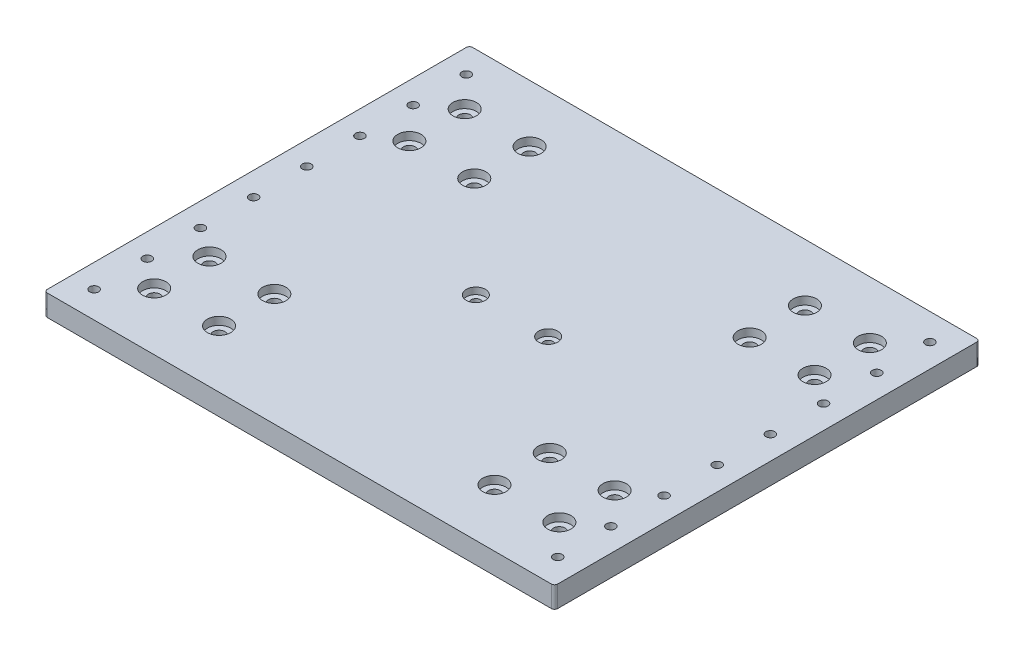
from build123d import *

# Parameters (mm, degrees)
SKETCH1_W                                        = 240
SKETCH1_H                                        = 200
BOSS_EXTRUDE1_DEPTH                              = 5
CBORE_FOR_M5_PAN_HEAD_MACHINE_SCREW1_D           = 5.5
CBORE_FOR_M5_PAN_HEAD_MACHINE_SCREW1_CBORE_D     = 11
CBORE_FOR_M5_PAN_HEAD_MACHINE_SCREW1_CBORE_DEPTH = 3.7
MIRROR2_COPY_1_D                                 = 5.5
MIRROR2_COPY_1_CBORE_D                           = 11
MIRROR2_COPY_1_CBORE_DEPTH                       = 3.7
MIRROR2_COPY_2_D                                 = 5.5
MIRROR2_COPY_2_CBORE_D                           = 11
MIRROR2_COPY_2_CBORE_DEPTH                       = 3.7
CBORE_FOR_M4_PAN_HEAD_MACHINE_SCREW1_D           = 4.5
CBORE_FOR_M4_PAN_HEAD_MACHINE_SCREW1_CBORE_D     = 9
CBORE_FOR_M4_PAN_HEAD_MACHINE_SCREW1_CBORE_DEPTH = 3.1
M5X0_8_TAPPED_HOLE1_D                            = 4.2
FILLET1_R                                        = 1.5
LPATTERN2_COUNT                                  = 8
LPATTERN2_PITCH                                  = 25


with BuildPart() as part:
    # Sketch1 → Boss-Extrude1 (new, symmetric)
    with BuildSketch(Plane(origin=(0, 0, 0), x_dir=(1, 0, 0), z_dir=(0, 1, 0))):
        Rectangle(SKETCH1_W, SKETCH1_H)
    extrude(amount=BOSS_EXTRUDE1_DEPTH, both=True)

    # CBORE for M5 Pan Head Machine Screw1 (through all)
    with Locations(Plane(origin=(66.92305649, 5, -81.969265096), x_dir=(-1, 0, 0), z_dir=(0, 1, 0))):
        with Locations((162.17305649, 154.969265096), (131.67305649, 154.969265096), (131.67305649, 128.969265096), (162.17305649, 128.969265096)):
            cbore_for_m5_pan_head_machine_screw1 = CounterBoreHole(CBORE_FOR_M5_PAN_HEAD_MACHINE_SCREW1_D / 2, CBORE_FOR_M5_PAN_HEAD_MACHINE_SCREW1_CBORE_D / 2, CBORE_FOR_M5_PAN_HEAD_MACHINE_SCREW1_CBORE_DEPTH)

    # Mirror1: CBORE for M5 Pan Head Machine Screw1 across plane
    add(cbore_for_m5_pan_head_machine_screw1.mirror(Plane(origin=(0, 0, 0), x_dir=(0, 0, 1), z_dir=(1, 0, 0))), mode=Mode.SUBTRACT)

    # Mirror2 copy 1 (through all)
    with Locations(Plane(origin=(-66.92305649, 5, 81.969265096), x_dir=(1, 0, 0), z_dir=(0, 1, 0))):
        with Locations((162.17305649, 154.969265096), (131.67305649, 154.969265096), (131.67305649, 128.969265096), (162.17305649, 128.969265096)):
            CounterBoreHole(MIRROR2_COPY_1_D / 2, MIRROR2_COPY_1_CBORE_D / 2, MIRROR2_COPY_1_CBORE_DEPTH)

    # Mirror2 copy 2 (through all)
    with Locations(Plane(origin=(66.92305649, 5, 81.969265096), x_dir=(-1, 0, 0), z_dir=(0, 1, 0))):
        with Locations((162.17305649, -154.969265096), (131.67305649, -154.969265096), (131.67305649, -128.969265096), (162.17305649, -128.969265096)):
            CounterBoreHole(MIRROR2_COPY_2_D / 2, MIRROR2_COPY_2_CBORE_D / 2, MIRROR2_COPY_2_CBORE_DEPTH)

    # CBORE for M4 Pan Head Machine Screw1 (through all)
    with Locations(Plane(origin=(-30.338508942, 5, -23.538498317), x_dir=(-1, 0, 0), z_dir=(0, 1, 0))):
        with Locations((-13.338508942, 23.538498317), (-47.338508942, 23.538498317)):
            CounterBoreHole(CBORE_FOR_M4_PAN_HEAD_MACHINE_SCREW1_D / 2, CBORE_FOR_M4_PAN_HEAD_MACHINE_SCREW1_CBORE_D / 2, CBORE_FOR_M4_PAN_HEAD_MACHINE_SCREW1_CBORE_DEPTH)

    # M5x0.8 Tapped Hole1 (through all)
    with Locations(Plane(origin=(0, 5, 0), x_dir=(1, 0, 0), z_dir=(0, 1, 0))):
        with Locations((-109, 87.5), (109, 87.5)):
            m5x0_8_tapped_hole1 = Hole(M5X0_8_TAPPED_HOLE1_D / 2)

    # Fillet1
    fillet1_edges = [part.edges().sort_by_distance(p)[0] for p in [
        (-120, 0, -100),
        (120, 0, -100),
        (-120, 0, 100),
        (120, 0, 100),
    ]]
    fillet(fillet1_edges, radius=FILLET1_R)

    # LPattern2: M5x0.8 Tapped Hole1 ×8
    with Locations(*[(0, 0, i * LPATTERN2_PITCH) for i in range(1, LPATTERN2_COUNT)]):
        add(m5x0_8_tapped_hole1, mode=Mode.SUBTRACT)


solid = part.part
